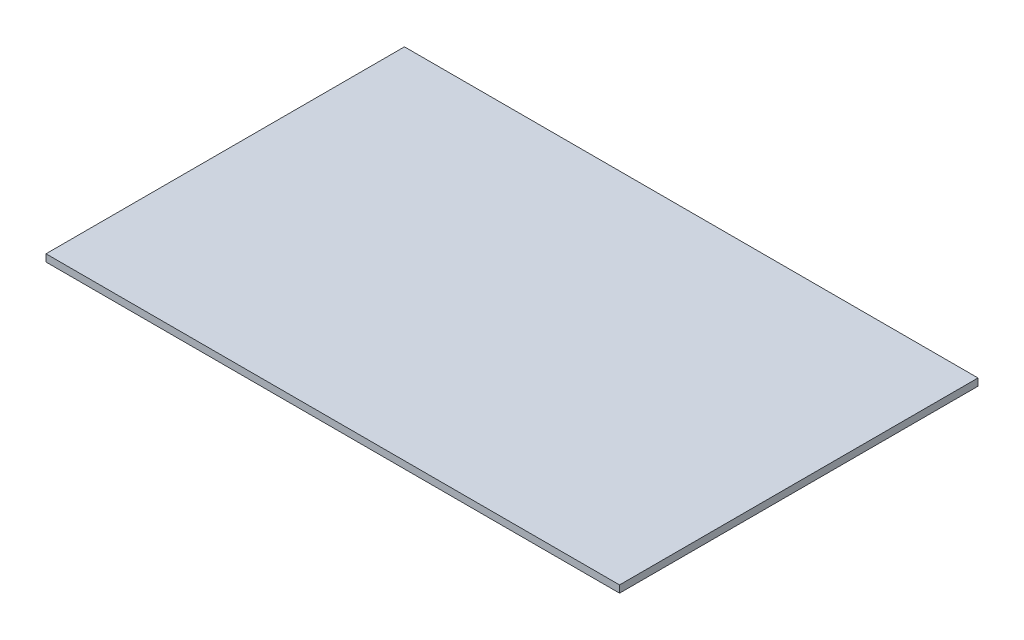
from build123d import *

# Parameters (mm, degrees)
SKETCH_1_W      = 160
SKETCH_1_H      = 100
EXTRUDE_1_DEPTH = 2


with BuildPart() as part:
    # Эскиз1 → Бобышка-Вытянуть1 (new body)
    with BuildSketch(Plane(origin=(0, 0, 0), x_dir=(1, 0, 0), z_dir=(0, 1, 0))):
        with Locations((80, 50)):
            Rectangle(SKETCH_1_W, SKETCH_1_H)
    extrude(amount=EXTRUDE_1_DEPTH)


solid = part.part
